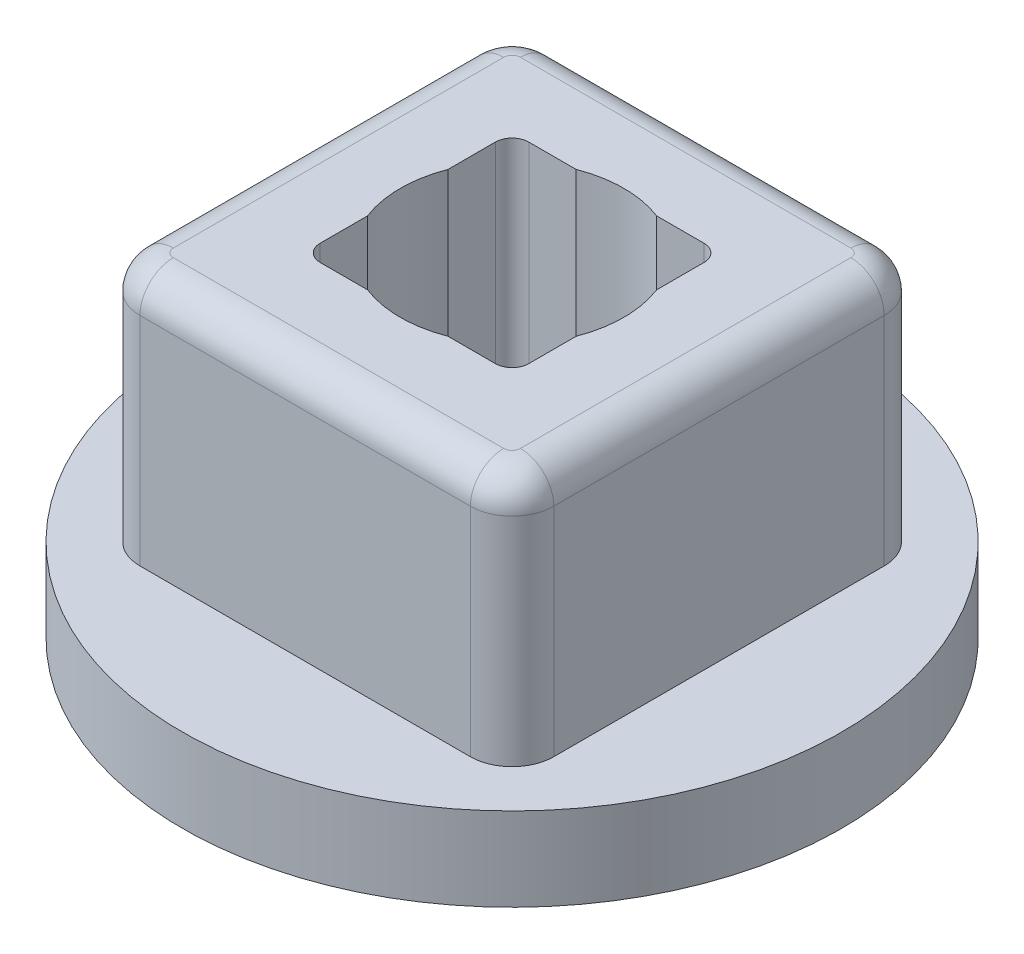
from build123d import *

# Parameters (mm, degrees)
SKETCH1_W           = 5.0165
SKETCH1_H           = 1.27
SKETCH2_W           = 6.2992
SKETCH2_H           = 6.2992
BOSS_EXTRUDE1_DEPTH = 3.81
SKETCH3_W           = 3.175
SKETCH3_H           = 3.175
CUT_EXTRUDE1_DEPTH  = 9.725648658
FILLET1_R           = 0.635
FILLET2_R           = 0.254
FILLET3_R           = 0.508
SKETCH4_R           = 1.7018
CUT_EXTRUDE2_DEPTH  = 51.054


with BuildPart() as part:
    # Sketch1 → Revolve1 (revolve)
    with BuildSketch(Plane.XY):
        with Locations((2.50825, 0.635)):
            Rectangle(SKETCH1_W, SKETCH1_H)
    revolve(axis=Axis((0, 1.27, 0), (0, -1, 0)))

    # Sketch2 → Boss-Extrude1 (add)
    with BuildSketch(Plane(origin=(0, 1.27, 0), x_dir=(-1, 0, 0), z_dir=(0, 1, 0))):
        Rectangle(SKETCH2_W, SKETCH2_H)
    extrude(amount=BOSS_EXTRUDE1_DEPTH)

    # Sketch3 → Cut-Extrude1 (cut, through all)
    with BuildSketch(Plane.XZ):
        Rectangle(SKETCH3_W, SKETCH3_H)
    extrude(amount=-CUT_EXTRUDE1_DEPTH, mode=Mode.SUBTRACT)

    # Fillet1
    fillet1_edges = [part.edges().sort_by_distance(p)[0] for p in [
        (-3.1496, 3.175, 3.1496),
        (3.1496, 3.175, 3.1496),
        (-3.1496, 3.175, -3.1496),
        (3.1496, 3.175, -3.1496),
    ]]
    fillet(fillet1_edges, radius=FILLET1_R)

    # Fillet2
    fillet2_edges = [part.edges().sort_by_distance(p)[0] for p in [
        (-1.5875, 2.54, 1.5875),
        (-1.5875, 2.54, -1.5875),
        (1.5875, 2.54, -1.5875),
        (1.5875, 2.54, 1.5875),
    ]]
    fillet(fillet2_edges, radius=FILLET2_R)

    # Fillet3
    fillet3_edges = [part.edges().sort_by_distance(p)[0] for p in [
        (-3.1496, 5.08, 0),
        (-2.963612806, 5.08, 2.963612806),
        (-2.963612806, 5.08, -2.963612806),
        (0, 5.08, 3.1496),
        (0, 5.08, -3.1496),
        (2.963612806, 5.08, 2.963612806),
        (2.963612806, 5.08, -2.963612806),
        (3.1496, 5.08, 0),
    ]]
    fillet(fillet3_edges, radius=FILLET3_R)

    # Sketch4 → Cut-Extrude2 (cut)
    with BuildSketch(Plane(origin=(0, 5.08, 0), x_dir=(1, 0, 0), z_dir=(0, 1, 0))):
        Circle(SKETCH4_R)
    extrude(amount=-CUT_EXTRUDE2_DEPTH, mode=Mode.SUBTRACT)


solid = part.part
